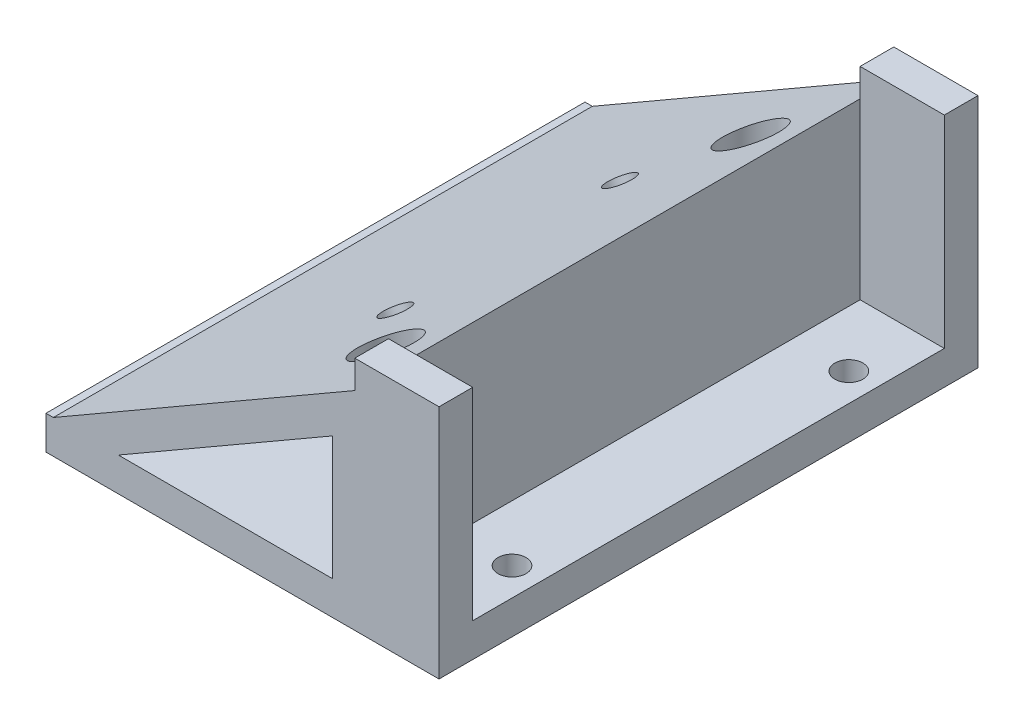
from build123d import *

# Parameters (mm, degrees)
SKETCH1_W                      = 35
SKETCH1_H                      = 48
BOSS_EXTRUDE1_DEPTH            = 3
SKETCH2_R                      = 1.5
SKETCH2_R_2                    = 1.25
CUT_EXTRUDE1_DEPTH             = 129.025488887
BOSS_EXTRUDE2_DEPTH            = 48
CUT_EXTRUDE5_DEPTH             = 118.034965653
CUT_EXTRUDE6_DEPTH             = 129.925466083
CUT_EXTRUDE6_DEPTH_BACK        = 1
SKETCH8_R                      = 2.5
CUT_EXTRUDE7_REACH             = 118.722
SKETCH9_R                      = 1.25
SKETCH10_R                     = 2.5
CUT_EXTRUDE8_DEPTH             = 0.5
CUT_EXTRUDE8_DIRECTION_2_REACH = 118.701
SKETCH11_W                     = 7.5
SKETCH11_H                     = 3
BOSS_EXTRUDE3_DEPTH            = 18


with BuildPart() as part:
    # Sketch1 → Boss-Extrude1 (new body)
    with BuildSketch(Plane(origin=(0, 0, 0), x_dir=(1, 0, 0), z_dir=(0, 1, 0))):
        with Locations((-87.623418825, 49.010907537)):
            Rectangle(SKETCH1_W, SKETCH1_H)
    extrude(amount=BOSS_EXTRUDE1_DEPTH)

    # Sketch2 → Cut-Extrude1 (cut, through all)
    with BuildSketch(Plane(origin=(0, 3, 0), x_dir=(1, 0, 0), z_dir=(0, 1, 0))):
        with Locations((-82.623418825, 65.263988229)):
            Circle(SKETCH2_R)
        with Locations((-82.623418825, 32.763988229)):
            Circle(SKETCH2_R)
        with Locations((-72.623418825, 34.010907537)):
            Circle(SKETCH2_R_2)
        with Locations((-72.623418825, 64.010907537)):
            Circle(SKETCH2_R_2)
    extrude(amount=-CUT_EXTRUDE1_DEPTH, mode=Mode.SUBTRACT)

    # Sketch4 → Boss-Extrude2 (add)
    with BuildSketch(Plane.XY.offset(-25.010907537)):
        Polygon((-77.623418825, 3), (-104.470206342, 3), (-77.623418825, 18.5), align=None)
    extrude(amount=-BOSS_EXTRUDE2_DEPTH)

    # Sketch6 → Cut-Extrude5 (cut, through all)
    with BuildSketch(Plane.XY.offset(-25.010907537)):
        Polygon((-98.675977708, 3), (-79.623418825, 3), (-79.623418825, 14), align=None)
    extrude(amount=-CUT_EXTRUDE5_DEPTH, mode=Mode.SUBTRACT)

    # Sketch8 → Cut-Extrude6 (cut, two sides: drawn at the far end of the back side and taken through both)
    with BuildSketch(Plane(origin=(0, 3, 0), x_dir=(1, 0, 0), z_dir=(0, 1, 0)).offset(-CUT_EXTRUDE6_DEPTH_BACK)):
        with Locations((-82.623418825, 32.763988229)):
            Circle(SKETCH8_R)
        with Locations((-82.623418825, 65.263988229)):
            Circle(SKETCH8_R)
    extrude(amount=CUT_EXTRUDE6_DEPTH + CUT_EXTRUDE6_DEPTH_BACK, mode=Mode.SUBTRACT)

    # Sketch9 → Cut-Extrude7 (cut, up to next)
    with BuildSketch(Plane(origin=(-27.416589691, 47.486926315, 0), x_dir=(0.8660254037844415, 0.49999999999999506, 0), z_dir=(-0.49999999999999506, 0.8660254037844415, 0)), mode=Mode.PRIVATE) as cut_extrude7_sk1:
        with Locations((-69.973852631, 59.010907537)):
            Circle(SKETCH9_R)
    cut_extrude7_tool1 = extrude(cut_extrude7_sk1.sketch, amount=-CUT_EXTRUDE7_REACH, mode=Mode.PRIVATE) & part.part
    # Sketch9 → Cut-Extrude7 (cut, up to next)
    with BuildSketch(Plane(origin=(-27.416589691, 47.486926315, 0), x_dir=(0.8660254037844415, 0.49999999999999506, 0), z_dir=(-0.49999999999999506, 0.8660254037844415, 0)), mode=Mode.PRIVATE) as cut_extrude7_sk2:
        with Locations((-69.973852631, 39.010907537)):
            Circle(SKETCH9_R)
    cut_extrude7_tool2 = extrude(cut_extrude7_sk2.sketch, amount=-CUT_EXTRUDE7_REACH, mode=Mode.PRIVATE) & part.part
    add(cut_extrude7_tool1.solids().sort_by_distance((-88.015724, 12.5, -59.010908))[0], mode=Mode.SUBTRACT)
    add(cut_extrude7_tool2.solids().sort_by_distance((-88.015724, 12.5, -39.010908))[0], mode=Mode.SUBTRACT)

    # Sketch10 → Cut-Extrude8 (cut)
    with BuildSketch(Plane(origin=(-25.968032533, 44.977951719, 0), x_dir=(-0.8660254037844358, -0.5000000000000049, 0), z_dir=(0.5000000000000049, -0.8660254037844358, 0))):
        with Locations((69.973852631, 59.010907537)):
            Circle(SKETCH10_R)
        with Locations((69.973852631, 39.010907537)):
            Circle(SKETCH10_R)
    extrude(amount=-CUT_EXTRUDE8_DEPTH, mode=Mode.SUBTRACT)

    # Sketch10 → Cut-Extrude8 direction 2 (cut, up to next)
    with BuildSketch(Plane(origin=(-25.968032533, 44.977951719, 0), x_dir=(-0.8660254037844358, -0.5000000000000049, 0), z_dir=(0.5000000000000049, -0.8660254037844358, 0)), mode=Mode.PRIVATE) as cut_extrude8_direction_2_sk1:
        with Locations((69.973852631, 59.010907537)):
            Circle(SKETCH10_R)
    cut_extrude8_direction_2_tool1 = extrude(cut_extrude8_direction_2_sk1.sketch, amount=CUT_EXTRUDE8_DIRECTION_2_REACH, mode=Mode.PRIVATE) & part.part
    # Sketch10 → Cut-Extrude8 direction 2 (cut, up to next)
    with BuildSketch(Plane(origin=(-25.968032533, 44.977951719, 0), x_dir=(-0.8660254037844358, -0.5000000000000049, 0), z_dir=(0.5000000000000049, -0.8660254037844358, 0)), mode=Mode.PRIVATE) as cut_extrude8_direction_2_sk2:
        with Locations((69.973852631, 39.010907537)):
            Circle(SKETCH10_R)
    cut_extrude8_direction_2_tool2 = extrude(cut_extrude8_direction_2_sk2.sketch, amount=CUT_EXTRUDE8_DIRECTION_2_REACH, mode=Mode.PRIVATE) & part.part
    add(cut_extrude8_direction_2_tool1.solids().sort_by_distance((-86.567167, 9.991025, -59.010908))[0], mode=Mode.SUBTRACT)
    add(cut_extrude8_direction_2_tool2.solids().sort_by_distance((-86.567167, 9.991025, -39.010908))[0], mode=Mode.SUBTRACT)

    # Sketch11 → Boss-Extrude3 (add)
    with BuildSketch(Plane(origin=(0, 3, 0), x_dir=(1, 0, 0), z_dir=(0, 1, 0))):
        with Locations((-73.873418825, 26.510907537)):
            Rectangle(SKETCH11_W, SKETCH11_H)
        with Locations((-73.873418825, 71.510907537)):
            Rectangle(SKETCH11_W, SKETCH11_H)
    extrude(amount=BOSS_EXTRUDE3_DEPTH)


solid = part.part
